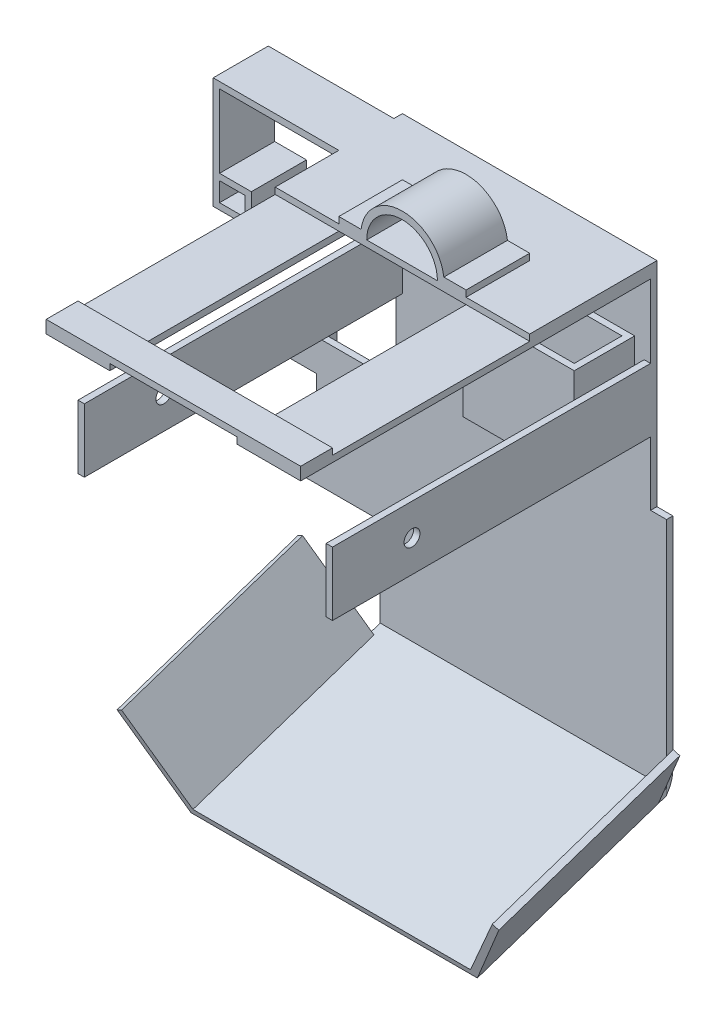
from build123d import *

# Parameters (mm, degrees)
SKETCH3_W            = 80
SKETCH3_H            = 65
SKETCH3_W_2          = 90
SKETCH3_H_2          = 75
BOSS_EXTRUDE1_DEPTH  = 2
SKETCH6_W            = 2
SKETCH6_H            = 20
BOSS_EXTRUDE2_DEPTH  = 100
SKETCH7_R            = 2.5
CUT_EXTRUDE2_DEPTH   = 168.735655124
SKETCH9_W            = 20
SKETCH9_H            = 2
BOSS_EXTRUDE3_DEPTH  = 110
BOSS_EXTRUDE4_DEPTH  = 90
FILLET1_R            = 10
SKETCH12_W           = 30
SKETCH12_H           = 60.261991402
BOSS_EXTRUDE5_DEPTH  = 2
CUT_EXTRUDE3_DEPTH   = 113
BOSS_EXTRUDE10_DEPTH = 60
SKETCH18_W           = 35
SKETCH18_H           = 30
BOSS_EXTRUDE11_DEPTH = 2
SKETCH19_W           = 2
SKETCH19_H           = 30
BOSS_EXTRUDE12_DEPTH = 15
SKETCH20_W           = 35
SKETCH20_H           = 30
BOSS_EXTRUDE13_DEPTH = 2
SKETCH21_W           = 80
SKETCH21_H           = 10
SKETCH21_H_2         = 40
BOSS_EXTRUDE14_DEPTH = 2
SKETCH22_W           = 20
SKETCH22_H           = 20
BOSS_EXTRUDE15_DEPTH = 20
CUT_EXTRUDE4_DEPTH   = 20
SKETCH24_W           = 2
SKETCH24_H           = 40
BOSS_EXTRUDE16_DEPTH = 20
SKETCH25_W           = 6.5
SKETCH25_H           = 10
BOSS_EXTRUDE17_DEPTH = 15
SKETCH27_W           = 11
SKETCH27_H           = 2.5
CUT_EXTRUDE5_DEPTH   = 165.450600485
SKETCH29_W           = 20
SKETCH29_H           = 35
BOSS_EXTRUDE18_DEPTH = 45
SKETCH32_W           = 5.5
SKETCH32_H           = 35
SKETCH32_W_2         = 8
SKETCH32_H_2         = 6
CUT_EXTRUDE10_DEPTH  = 45
SKETCH33_W           = 39.484783522
SKETCH33_H           = 2.678161959
CUT_EXTRUDE12_DEPTH  = 37


with BuildPart() as part:
    # Sketch3 → Boss-Extrude1 (new body)
    with BuildSketch(Plane.XY):
        with Locations((0, 70)):
            Rectangle(SKETCH3_W, SKETCH3_H)
        Rectangle(SKETCH3_W_2, SKETCH3_H_2)
    extrude(amount=BOSS_EXTRUDE1_DEPTH)

    # Sketch6 → Boss-Extrude2 (add)
    with BuildSketch(Plane.XY.offset(2)):
        with Locations((-39, 67.5)):
            Rectangle(SKETCH6_W, SKETCH6_H)
        with Locations((39, 67.5)):
            Rectangle(SKETCH6_W, SKETCH6_H)
    extrude(amount=BOSS_EXTRUDE2_DEPTH)

    # Sketch7 → Cut-Extrude2 (cut, through all)
    with BuildSketch(Plane(origin=(40, 0, 0), x_dir=(0, 0, -1), z_dir=(1, 0, 0))):
        with Locations(Location((-77, 67.5, 0), (0, 0, 90))):
            Circle(SKETCH7_R)
    extrude(amount=-CUT_EXTRUDE2_DEPTH, mode=Mode.SUBTRACT)

    # Sketch9 → Boss-Extrude3 (add)
    with BuildSketch(Plane.XY.offset(2)):
        with Locations((-30, 101.5)):
            Rectangle(SKETCH9_W, SKETCH9_H)
        with Locations((30, 101.5)):
            Rectangle(SKETCH9_W, SKETCH9_H)
    extrude(amount=BOSS_EXTRUDE3_DEPTH)

    # Fillet1
    # the kernel refuses this fillet: 10 mm, written as the material it takes off along each edge
    with BuildSketch(Plane(origin=(-60, -37.5, 0), x_dir=(0, 0, 1), z_dir=(1, 0, 0))) as fillet1_piece_1:
        with BuildLine():
            CenterArc((10, -6), FILLET1_R, 143.130102354, 36.869897646)
            Line((0, -6), (-0.2, -6))
            Line((-0.2, -6), (-0.2, 0))
            Line((-0.2, 0), (0, 0.2))
            ThreePointArc((0, 0.2), (1, 0.2), (1.84, 0.12))
            Line((1.84, 0.12), (2, 0))
        make_face()
    extrude(amount=120, mode=Mode.SUBTRACT)

    # Sketch12 → Boss-Extrude5 (add)
    with BuildSketch(Plane(origin=(0, 0, 0), x_dir=(-1, 0, 0), z_dir=(0, 0, -1))):
        with Locations((0, -27.654978505)):
            Rectangle(SKETCH12_W, SKETCH12_H)
    extrude(amount=BOSS_EXTRUDE5_DEPTH)

    # Sketch18 → Boss-Extrude11 (add)
    with BuildSketch(Plane.XY.offset(2)):
        with Locations((17.5, 67.5)):
            Rectangle(SKETCH18_W, SKETCH18_H)
    extrude(amount=BOSS_EXTRUDE11_DEPTH)

    # Sketch19 → Boss-Extrude12 (add)
    with BuildSketch(Plane.XY.offset(4)):
        with Locations((34, 67.5)):
            Rectangle(SKETCH19_W, SKETCH19_H)
    extrude(amount=BOSS_EXTRUDE12_DEPTH)

    # Sketch20 → Boss-Extrude13 (add)
    with BuildSketch(Plane.XY.offset(19)):
        with Locations((17.5, 67.5)):
            Rectangle(SKETCH20_W, SKETCH20_H)
    extrude(amount=BOSS_EXTRUDE13_DEPTH)

    # Sketch21 → Boss-Extrude14 (add)
    with BuildSketch(Plane(origin=(0, 102.5, 0), x_dir=(1, 0, 0), z_dir=(0, 1, 0))):
        with Locations((0, -107)):
            Rectangle(SKETCH21_W, SKETCH21_H)
        with Locations((0, -20)):
            Rectangle(SKETCH21_W, SKETCH21_H_2)
    extrude(amount=BOSS_EXTRUDE14_DEPTH)

    # Sketch22 → Boss-Extrude15 (add)
    with BuildSketch(Plane(origin=(0, 104.5, 0), x_dir=(1, 0, 0), z_dir=(0, 1, 0))):
        with Locations((-10, -30)):
            Rectangle(SKETCH22_W, SKETCH22_H)
        with Locations((10, -30)):
            Rectangle(SKETCH22_W, SKETCH22_H)
    extrude(amount=BOSS_EXTRUDE15_DEPTH)

    # Sketch23 → Cut-Extrude4 (cut)
    with BuildSketch(Plane(origin=(0, 0, 20), x_dir=(-1, 0, 0), z_dir=(0, 0, -1))):
        with BuildLine():
            Line((-20, 124.5), (-20, 106.5))
            Line((-20, 106.5), (-13, 106.5))
            ThreePointArc((-13, 106.5), (0, 117.954368483), (13, 106.5))
            Line((13, 106.5), (20, 106.5))
            Line((20, 106.5), (20, 124.5))
            Line((20, 124.5), (-20, 124.5))
        make_face()
        with BuildLine():
            ThreePointArc((11.234714386, 104.5), (0.121034595, 115.61367979), (-10.992645195, 104.5))
            Line((-10.992645195, 104.5), (11.234714386, 104.5))
        make_face()
    extrude(amount=-CUT_EXTRUDE4_DEPTH, mode=Mode.SUBTRACT)

    # Sketch24 → Boss-Extrude16 (add)
    with BuildSketch(Plane.ZY.offset(45)):
        with Locations((1, 12.214025794)):
            Rectangle(SKETCH24_W, SKETCH24_H)
    extrude(amount=BOSS_EXTRUDE16_DEPTH)

    # Sketch25 → Boss-Extrude17 (add)
    with BuildSketch(Plane.ZY.offset(65)):
        with Locations((-1.25, 27.214025794)):
            Rectangle(SKETCH25_W, SKETCH25_H)
        with Locations((-1.25, -2.785974206)):
            Rectangle(SKETCH25_W, SKETCH25_H)
    extrude(amount=BOSS_EXTRUDE17_DEPTH)

    # Sketch27 → Cut-Extrude5 (cut, through all)
    with BuildSketch(Plane(origin=(0, 32.214025794, 0), x_dir=(1, 0, 0), z_dir=(0, 1, 0))):
        with Locations((-72.5, 1.25)):
            Rectangle(SKETCH27_W, SKETCH27_H)
    extrude(amount=-CUT_EXTRUDE5_DEPTH, mode=Mode.SUBTRACT)

    # Sketch29 → Boss-Extrude18 (add)
    with BuildSketch(Plane.ZY.offset(40)):
        with Locations((10, 87)):
            Rectangle(SKETCH29_W, SKETCH29_H)
    extrude(amount=BOSS_EXTRUDE18_DEPTH)

    # Sketch32 → Cut-Extrude10 (cut)
    with BuildSketch(Plane(origin=(0, 0, 0), x_dir=(-1, 0, 0), z_dir=(0, 0, -1))):
        Polygon((40, 102.5), (77.5, 102.5), (77.5, 79.5), (67.5, 79.5), (67.5, 69.5), (40, 69.5), align=None)
        with Locations((82.25, 87)):
            Rectangle(SKETCH32_W, SKETCH32_H)
        with Locations((73.5, 74.5)):
            Rectangle(SKETCH32_W_2, SKETCH32_H_2)
    extrude(amount=-CUT_EXTRUDE10_DEPTH, mode=Mode.SUBTRACT)

    # Sketch33 → Cut-Extrude12 (cut)
    with BuildSketch(Plane(origin=(0, 104.5, 0), x_dir=(1, 0, 0), z_dir=(0, 1, 0))):
        with Locations((-59.757608239, -1.33908098)):
            Rectangle(SKETCH33_W, SKETCH33_H)
    extrude(amount=-CUT_EXTRUDE12_DEPTH, mode=Mode.SUBTRACT)


with BuildPart() as body_2:
    # Sketch10 → Boss-Extrude4 (new body)
    with BuildSketch(Plane(origin=(45, 0, 0), x_dir=(0, 0, -1), z_dir=(1, 0, 0))):
        Polygon((-2.058926134, -37.701447462), (-62.058926134, -57.785974206), (-62.058926134, -55.785974206), (-2, -35.681722403), align=None)
    extrude(amount=-BOSS_EXTRUDE4_DEPTH)

    # Sketch14 → Cut-Extrude3 (cut)
    with BuildSketch(Plane(origin=(45, 0, 0), x_dir=(0, 0, -1), z_dir=(1, 0, 0))):
        Polygon((-62.058926134, -55.785974206), (-58.636316443, -66.010590601), (-73.036947703, -70.831088329), align=None)
    extrude(amount=-CUT_EXTRUDE3_DEPTH, mode=Mode.SUBTRACT)

    # Sketch15 → Boss-Extrude10 (add)
    with BuildSketch(Plane(origin=(0, -24.301628774, 72.598062431), x_dir=(1, 0, 0), z_dir=(0, -0.3174298395941448, 0.9482817603092635))):
        Polygon((-45, -35.098030373), (-60, -9.117268259), (-58.267949192, -8.117268259), (-42.690598923, -35.098030373), align=None)
        Polygon((45, -35.098030373), (60, -9.117268259), (58.267949192, -8.117268259), (42.337684751, -35.098030373), align=None)
    extrude(amount=-BOSS_EXTRUDE10_DEPTH)


solid = Compound([part.part, body_2.part])
